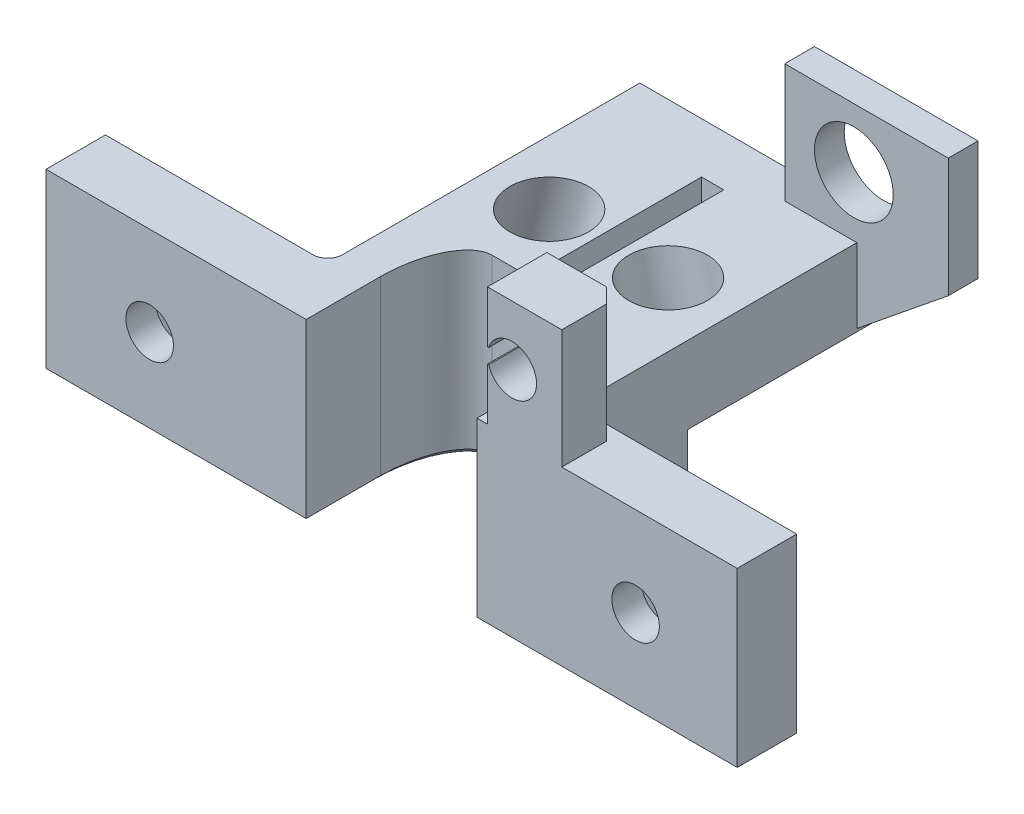
from build123d import *

# Parameters (mm, degrees)
BOSS_EXTRUDE1_DEPTH = 12
CUT_EXTRUDE1_DEPTH  = 2
SKETCH3_W           = 16.6
SKETCH3_H           = 13.4
BOSS_EXTRUDE2_DEPTH = 5.2
SKETCH5_R           = 1.6
CUT_EXTRUDE2_DEPTH  = 5
SKETCH6_W           = 5
SKETCH6_H           = 4
BOSS_EXTRUDE4_DEPTH = 8
CUT_EXTRUDE4_DEPTH  = 7
SKETCH8_R           = 2.65
CUT_EXTRUDE5_DEPTH  = 7
SKETCH10_R          = 2.65
CUT_EXTRUDE6_DEPTH  = 7
CHAMFER2_SIZE       = 2
CHAMFER3_SIZE       = 1
SKETCH12_W          = 3
SKETCH12_H          = 2
SKETCH12_W_2        = 6.148694825
SKETCH12_W_3        = 1.851305175
BOSS_EXTRUDE5_DEPTH = 8
SKETCH13_R          = 2.65
CUT_EXTRUDE7_DEPTH  = 3
CHAMFER4_SIZE       = 5
CHAMFER4_SIZE_2     = 6.174485783
SKETCH16_W          = 1.5
SKETCH16_H          = 10
CUT_EXTRUDE8_DEPTH  = 11
CHAMFER5_SIZE       = 0.4


with BuildPart() as part:
    # Sketch1 → Boss-Extrude1 (new body)
    with BuildSketch(Plane(origin=(0, 0, 0), x_dir=(1, 0, 0), z_dir=(0, 1, 0))):
        with BuildLine():
            Line((-23.25, -5), (-5.749755012, -5))
            Line((-5.749755012, -5), (-5.749755012, 0))
            add(Edge.make_bspline(
                [(-3.25, 5), (-5.749755012, 5), (-5.749755012, 0)],
                knots=[0, 0, 0, 1.570796327, 1.570796327, 1.570796327], degree=2, weights=[1, 0.707106781, 1]))
            Line((-3.25, 5), (3.25, 5))
            add(Edge.make_bspline(
                [(5.748694825, 0), (5.748694825, 5), (3.25, 5)],
                knots=[4.71238898, 4.71238898, 4.71238898, 6.283185307, 6.283185307, 6.283185307], degree=2, weights=[1, 0.707106781, 1]))
            Line((5.748694825, 0), (5.748694825, -5))
            Line((5.748694825, -5), (23.25, -5))
            Line((23.25, -5), (23.25, -3))
            Line((23.25, -3), (23.25, -1))
            Line((23.25, -1), (9.3, -1))
            ThreePointArc((9.3, -1), (8.592893219, -0.707106781), (8.3, 0))
            Line((8.3, 0), (8.3, 6.6))
            Line((8.3, 6.6), (-8.3, 6.6))
            Line((-8.3, 6.6), (-8.3, 0))
            ThreePointArc((-8.3, 0), (-8.592893219, -0.707106781), (-9.3, -1))
            Line((-9.3, -1), (-23.25, -1))
            Line((-23.25, -1), (-23.25, -5))
        make_face()
    extrude(amount=BOSS_EXTRUDE1_DEPTH)

    # Sketch2 → Cut-Extrude1 (cut)
    with BuildSketch(Plane(origin=(0, 0, 1), x_dir=(-1, 0, 0), z_dir=(0, 0, -1))):
        Polygon((20.147177825, 6), (18.213054423, 9.35), (14.344807619, 9.35), (12.410684218, 6), (14.344807619, 2.65), (18.213054423, 2.65), align=None)
        Polygon((-12.542169585, 6), (-14.476292987, 9.35), (-18.34453979, 9.35), (-20.278663192, 6), (-18.34453979, 2.65), (-14.476292987, 2.65), align=None)
    extrude(amount=-CUT_EXTRUDE1_DEPTH, mode=Mode.SUBTRACT)

    # Sketch3 → Boss-Extrude2 (add)
    with BuildSketch(Plane(origin=(0, 12, 0), x_dir=(1, 0, 0), z_dir=(0, 1, 0))):
        with Locations((0, 13.3)):
            Rectangle(SKETCH3_W, SKETCH3_H)
    extrude(amount=-BOSS_EXTRUDE2_DEPTH)

    # Sketch5 → Cut-Extrude2 (cut)
    with BuildSketch(Plane(origin=(0, 0, 1), x_dir=(-1, 0, 0), z_dir=(0, 0, -1))):
        with Locations((-16.410416388, 6)):
            Circle(SKETCH5_R)
        with Locations((16.278931021, 6)):
            Circle(SKETCH5_R)
    extrude(amount=-CUT_EXTRUDE2_DEPTH, mode=Mode.SUBTRACT)

    # Sketch6 → Boss-Extrude4 (add)
    with BuildSketch(Plane(origin=(0, 12, 0), x_dir=(1, 0, 0), z_dir=(0, 1, 0))):
        with Locations((8.948694825, -3)):
            Rectangle(SKETCH6_W, SKETCH6_H)
    extrude(amount=BOSS_EXTRUDE4_DEPTH)

    # Sketch7 → Cut-Extrude4 (cut)
    with BuildSketch(Plane(origin=(0, 0, 1), x_dir=(-1, 0, 0), z_dir=(0, 0, -1))):
        with BuildLine():
            ThreePointArc((-6.448694825, 16), (-6.468205549, 16.252991544), (-6.526276305, 16.5))
            Line((-6.526276305, 16.5), (-7.999397269, 16.5))
            Line((-7.999397269, 16.5), (-7.999397269, 15.5))
            Line((-7.999397269, 15.5), (-6.526276305, 15.5))
            ThreePointArc((-6.526276305, 15.5), (-6.468205549, 15.747008456), (-6.448694825, 16))
        make_face()
        with BuildLine():
            Line((-7.999397269, 16.5), (-6.526276305, 16.5))
            ThreePointArc((-6.526276305, 16.5), (-9.748694825, 16), (-6.526276305, 15.5))
            Line((-6.526276305, 15.5), (-7.999397269, 15.5))
            Line((-7.999397269, 15.5), (-7.999397269, 16.5))
        make_face()
        with BuildLine():
            Line((-6.448694825, 15.5), (-6.448694825, 16))
            ThreePointArc((-6.448694825, 16), (-6.468205549, 15.747008456), (-6.526276305, 15.5))
            Line((-6.526276305, 15.5), (-6.448694825, 15.5))
        make_face()
        with BuildLine():
            Line((-6.448694825, 16), (-6.448694825, 16.5))
            Line((-6.448694825, 16.5), (-6.526276305, 16.5))
            ThreePointArc((-6.526276305, 16.5), (-6.468205549, 16.252991544), (-6.448694825, 16))
        make_face()
    extrude(amount=-CUT_EXTRUDE4_DEPTH, mode=Mode.SUBTRACT)

    # Sketch8 → Cut-Extrude5 (cut, along a direction that is not the sketch's normal)
    with BuildSketch(Plane(origin=(0, 12, 0), x_dir=(1, 0, 0), z_dir=(0, 1, 0))):
        with Locations((-4, 9.6)):
            Circle(SKETCH8_R)
    extrude(amount=-CUT_EXTRUDE5_DEPTH, dir=(0.2588190451025147, 0.96592582628907, -1.457918124587514e-13), mode=Mode.SUBTRACT)

    # Sketch10 → Cut-Extrude6 (cut, along a direction that is not the sketch's normal)
    with BuildSketch(Plane(origin=(0, 12, 0), x_dir=(1, 0, 0), z_dir=(0, 1, 0))):
        with Locations((4, 9.6)):
            Circle(SKETCH10_R)
    extrude(amount=-CUT_EXTRUDE6_DEPTH, dir=(-0.25881904510251447, 0.96592582628907, 0), mode=Mode.SUBTRACT)

    # Chamfer2
    chamfer2_edges = [part.edges().sort_by_distance(p)[0] for p in [
        (7.874347412, 12, 1),
    ]]
    chamfer(chamfer2_edges, length=CHAMFER2_SIZE)

    # Chamfer3
    chamfer3_edges = [part.edges().sort_by_distance(p)[0] for p in [
        (11.448694825, 16, 1),
    ]]
    chamfer(chamfer3_edges, length=CHAMFER3_SIZE)

    # Sketch12 → Boss-Extrude5 (add)
    with BuildSketch(Plane(origin=(0, 12, 0), x_dir=(1, 0, 0), z_dir=(0, 1, 0))):
        with Locations((4.948694825, 19)):
            Rectangle(SKETCH12_W, SKETCH12_H)
        with Locations((11.374347413, 19)):
            Rectangle(SKETCH12_W_2, SKETCH12_H)
        with Locations((7.374347413, 19)):
            Rectangle(SKETCH12_W_3, SKETCH12_H)
    extrude(amount=BOSS_EXTRUDE5_DEPTH)

    # Sketch13 → Cut-Extrude7 (cut)
    with BuildSketch(Plane(origin=(0, 0, -20), x_dir=(-1, 0, 0), z_dir=(0, 0, -1))):
        with Locations((-8.098694825, 16)):
            Circle(SKETCH13_R)
    extrude(amount=-CUT_EXTRUDE7_DEPTH, mode=Mode.SUBTRACT)

    # Chamfer4
    # the kernel refuses this chamfer: 6.174485783, 5 mm, written as the material it adds along each edge
    with BuildSketch(Plane(origin=(8.3, 12, -18), x_dir=(-0.037204697112204525, -0.9993076655929289, 0), z_dir=(0, 0, -1))) as chamfer4_piece_1_section:
        Polygon((CHAMFER4_SIZE * 0.999307665593, -CHAMFER4_SIZE * 0.0372046971122), (-CHAMFER4_SIZE_2 * 0.0372046971102, -CHAMFER4_SIZE_2 * 0.99930766554), (0, 0), align=None)
    chamfer4_piece_1 = extrude(amount=2, mode=Mode.PRIVATE)
    chamfer4_piece_1 = split(chamfer4_piece_1, bisect_by=Plane(origin=(14.448694825, 10.333304375, -19), z_dir=(-1, 0, 0)), keep=Keep.TOP, mode=Mode.PRIVATE)
    add(chamfer4_piece_1)

    # Sketch16 → Cut-Extrude8 (cut)
    with BuildSketch(Plane.XZ.offset(-6.8)):
        with Locations((0, -11.6)):
            Rectangle(SKETCH16_W, SKETCH16_H)
    extrude(amount=-CUT_EXTRUDE8_DEPTH, mode=Mode.SUBTRACT)

    # Chamfer5
    chamfer5_edges = [part.edges().sort_by_distance(p)[0] for p in [
        (0, 0, -5),
        (-5.260112096, 0, -2.972310439),
        (-5.749755012, 0, 2.5),
        (-14.499877506, 0, 5),
        (-23.25, 0, 3),
        (-16.275, 0, 1),
        (-8.592893219, 0, 0.707106781),
        (-8.3, 0, -3.3),
        (0, 0, -6.6),
        (8.3, 0, -3.3),
        (8.592893219, 0, 0.707106781),
        (16.275, 0, 1),
        (23.25, 0, 3),
        (14.499347412, 0, 5),
        (5.748694825, 0, 2.5),
        (5.259369228, 0, -2.972013605),
    ]]
    chamfer(chamfer5_edges, length=CHAMFER5_SIZE)


solid = part.part
